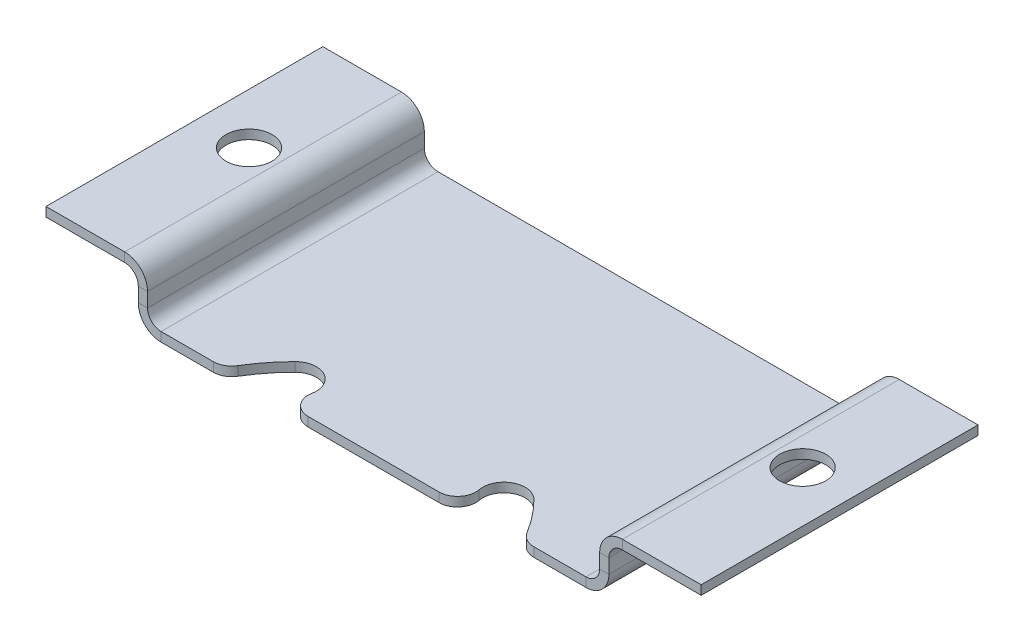
from build123d import *

# Parameters (mm, degrees)
BASE_FLANGE1_DEPTH = 7.5
SKETCH6_R          = 1.25
CUT_EXTRUDE1_DEPTH = 10
CUT_EXTRUDE2_DEPTH = 10
FILLET1_R          = 1


# Sheet-metal steps are written as plain solids
with BuildPart() as part:
    # Sketch1 → Base-Flange1 (new, symmetric)
    with BuildSketch(Plane.XY):
        with BuildLine():
            Line((-17.75, 2.75), (-13.4866, 2.75))
            ThreePointArc((-13.4866, 2.75), (-12.965745145, 2.534254855), (-12.75, 2.0134))
            Line((-12.75, 2.0134), (-12.75, 1.2366))
            ThreePointArc((-12.75, 1.2366), (-12.387808246, 0.362191754), (-11.5134, 0))
            Line((-11.5134, 0), (11.5134, 0))
            ThreePointArc((11.5134, 0), (12.387808246, 0.362191754), (12.75, 1.2366))
            Line((12.75, 1.2366), (12.75, 2.0134))
            ThreePointArc((12.75, 2.0134), (12.965745145, 2.534254855), (13.4866, 2.75))
            Line((13.4866, 2.75), (17.75, 2.75))
            Line((17.75, 2.75), (17.75, 3.25))
            Line((17.75, 3.25), (13.4866, 3.25))
            ThreePointArc((13.4866, 3.25), (12.612191754, 2.887808246), (12.25, 2.0134))
            Line((12.25, 2.0134), (12.25, 1.2366))
            ThreePointArc((12.25, 1.2366), (12.034254855, 0.715745145), (11.5134, 0.5))
            Line((11.5134, 0.5), (-11.5134, 0.5))
            ThreePointArc((-11.5134, 0.5), (-12.034254855, 0.715745145), (-12.25, 1.2366))
            Line((-12.25, 1.2366), (-12.25, 2.0134))
            ThreePointArc((-12.25, 2.0134), (-12.612191754, 2.887808246), (-13.4866, 3.25))
            Line((-13.4866, 3.25), (-17.75, 3.25))
            Line((-17.75, 3.25), (-17.75, 2.75))
        make_face()
    extrude(amount=BASE_FLANGE1_DEPTH, both=True)

    # Sketch6 → Cut-Extrude1 (cut)
    with BuildSketch(Plane.XZ.offset(-2.75)):
        with Locations(Location((-15, -0.75, 0), (0, 0, 270))):
            Circle(SKETCH6_R)
        with Locations(Location((15, -0.75, 0), (0, 0, 270))):
            Circle(SKETCH6_R)
    extrude(amount=-CUT_EXTRUDE1_DEPTH, mode=Mode.SUBTRACT)

    # Sketch7 → Cut-Extrude2 (cut)
    with BuildSketch(Plane.XZ):
        with BuildLine():
            ThreePointArc((-6.470027047, 5.279972953), (-4.843681451, 5.279972953), (-4.843681451, 6.906318549))
            ThreePointArc((-4.843681451, 6.906318549), (0, 18.599999999), (4.843681451, 6.906318549))
            ThreePointArc((4.843681451, 6.906318549), (4.843681451, 5.279972953), (6.470027047, 5.279972953))
            ThreePointArc((6.470027047, 5.279972953), (0, 20.899999999), (-6.470027047, 5.279972953))
        make_face()
    extrude(amount=-CUT_EXTRUDE2_DEPTH, mode=Mode.SUBTRACT)

    # Fillet1
    fillet1_edges = [part.edges().sort_by_distance(p)[0] for p in [
        (8.103085831, 0.25, 7.5),
        (-8.103085831, 0.25, 7.5),
        (-5.372150407, 0.25, 7.5),
        (5.372150407, 0.25, 7.5),
    ]]
    fillet(fillet1_edges, radius=FILLET1_R)


solid = part.part
